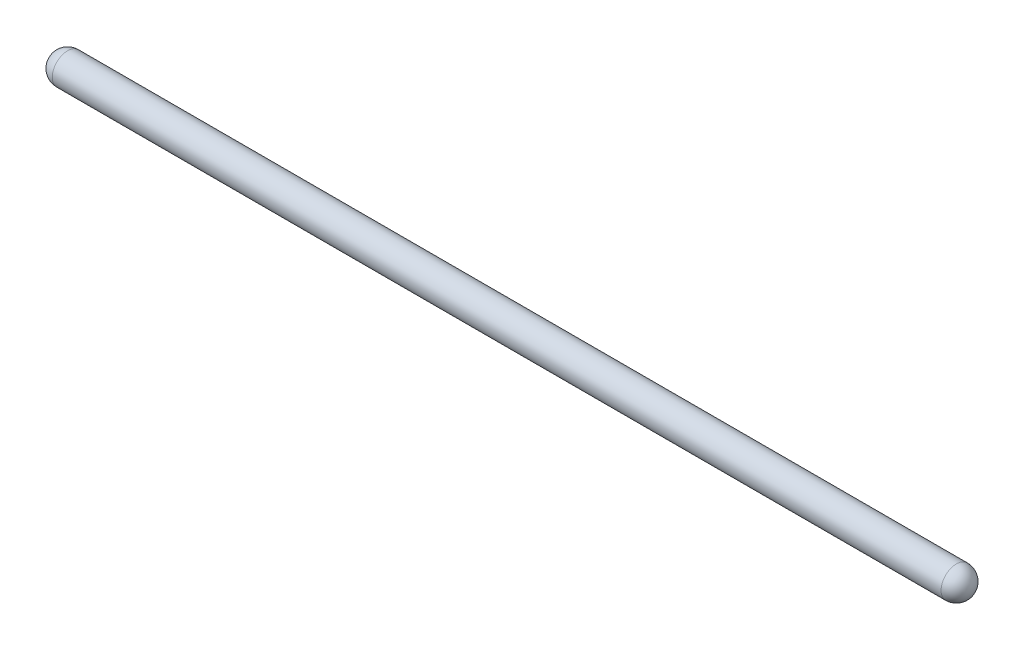
from build123d import *


with BuildPart() as part:
    # Sketch1 → Revolve1 (revolve)
    with BuildSketch(Plane.XY):
        with BuildLine():
            Line((2.5, 2.5), (147.5, 2.5))
            ThreePointArc((147.5, 2.5), (149.267766953, 1.767766953), (150, 0))
            Line((150, 0), (0, 0))
            ThreePointArc((0, 0), (0.732233047, 1.767766953), (2.5, 2.5))
        make_face()
    revolve(axis=Axis((0, 0, 0), (1, 0, 0)))


solid = part.part
